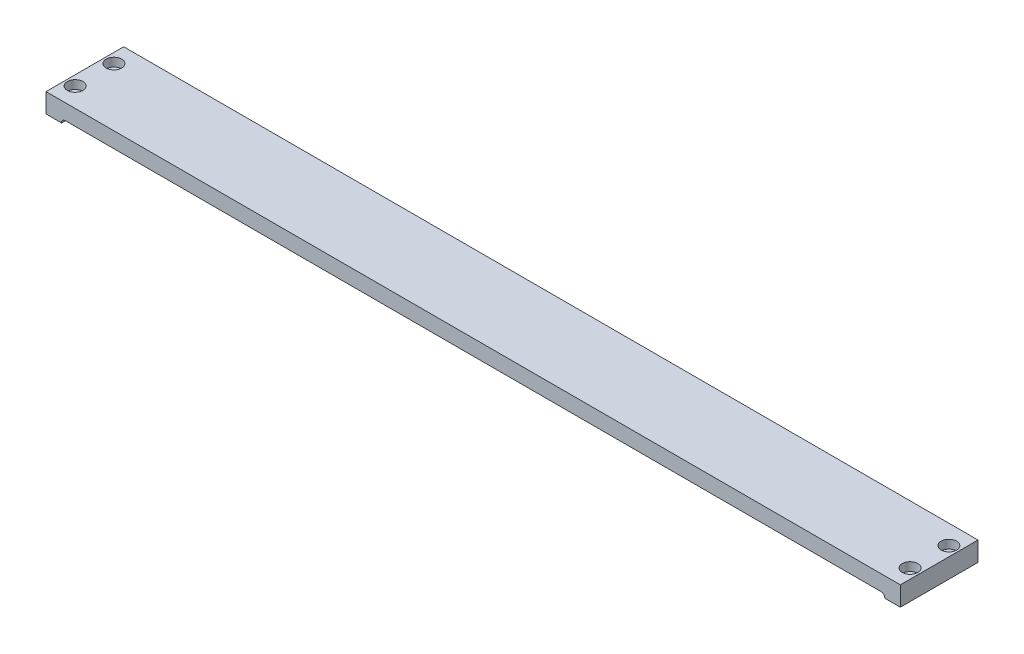
from build123d import *

# Parameters (mm, degrees)
SKETCH1_W                                    = 440
SKETCH1_H                                    = 40
BOSS_EXTRUDE1_DEPTH                          = 10
SKETCH2_W                                    = 424
SKETCH2_H                                    = 2
CUT_EXTRUDE1_DEPTH                           = 2
FILLET1_R                                    = 2
CBORE_FOR_M4_HEX_SOCKET_HEAD_CAP_SCR_2_COUNT = 2
CBORE_FOR_M4_HEX_SOCKET_HEAD_CAP_SCR_2_PITCH = 20
M4X0_7_TAPPED_HOLE1_D                        = 3.3
M4X0_7_TAPPED_HOLE1_DEPTH                    = 14
M4X0_7_TAPPED_HOLE1_TIP                      = 0.991420021


with BuildPart() as part:
    # Sketch1 → Boss-Extrude1 (new body)
    with BuildSketch(Plane(origin=(0, 0, 0), x_dir=(1, 0, 0), z_dir=(0, 1, 0))):
        Rectangle(SKETCH1_W, SKETCH1_H)
    extrude(amount=BOSS_EXTRUDE1_DEPTH)

    # Sketch2 → Cut-Extrude1 (cut)
    with BuildSketch(Plane.XY.offset(20)):
        with Locations((0, 1)):
            Rectangle(SKETCH2_W, SKETCH2_H)
    extrude(amount=-CUT_EXTRUDE1_DEPTH, mode=Mode.SUBTRACT)

    # Fillet1
    fillet1_edges = [part.edges().sort_by_distance(p)[0] for p in [
        (-212, 2, 19),
        (212, 2, 19),
    ]]
    fillet(fillet1_edges, radius=FILLET1_R - 0.0001)  # a hair under: the kernel refuses the full size

    # Sketch4 → CBORE for M4 Hex Socket Head Cap Screw1 (revolve, cut)
    with BuildSketch(Plane(origin=(-215, 10, -10), x_dir=(0, 0, 1), z_dir=(1, 0, 0))):
        Polygon((0, 0), (0, 15.351936393), (2.25, 14), (2.25, 4.4), (4, 4.4), (4, 0), align=None)
    cbore_for_m4_hex_socket_head_cap_screw1 = revolve(axis=Axis((-215, 16.35, -10), (0, -1, 0)), mode=Mode.SUBTRACT)

    # CBORE for M4 Hex Socket Head Cap Scr 2: CBORE for M4 Hex Socket Head Cap Screw1 ×2
    with Locations(*[(0, 0, i * CBORE_FOR_M4_HEX_SOCKET_HEAD_CAP_SCR_2_PITCH) for i in range(1, CBORE_FOR_M4_HEX_SOCKET_HEAD_CAP_SCR_2_COUNT)]):
        add(cbore_for_m4_hex_socket_head_cap_screw1, mode=Mode.SUBTRACT)

    # Mirror1: CBORE for M4 Hex Socket Head Cap Screw1 across plane
    add(cbore_for_m4_hex_socket_head_cap_screw1.mirror(Plane(origin=(0, 0, 0), x_dir=(0, 0, 1), z_dir=(1, 0, 0))), mode=Mode.SUBTRACT)

    # Mirror1 copy 1 sketch → Mirror1 copy 1 (revolve, cut)
    with BuildSketch(Plane(origin=(215, 10, 10), x_dir=(0, 0, 1), z_dir=(-1, 0, 0))):
        Polygon((0, 0), (0, -15.351936393), (2.25, -14), (2.25, -4.4), (4, -4.4), (4, 0), align=None)
    revolve(axis=Axis((215, 16.35, 10), (0, 1, 0)), mode=Mode.SUBTRACT)

    # M4x0.7 Tapped Hole1
    with Locations(Plane(origin=(0, 0, -20), x_dir=(-1, 0, 0), z_dir=(0, 0, -1))):
        with Locations((125, 5), (0, 5), (-125, 5)):
            Hole(M4X0_7_TAPPED_HOLE1_D / 2, depth=M4X0_7_TAPPED_HOLE1_DEPTH)
            with Locations((0, 0, -(M4X0_7_TAPPED_HOLE1_DEPTH + M4X0_7_TAPPED_HOLE1_TIP / 2))):  # 118° drill point
                Cone(0, M4X0_7_TAPPED_HOLE1_D / 2, M4X0_7_TAPPED_HOLE1_TIP, mode=Mode.SUBTRACT)


solid = part.part
